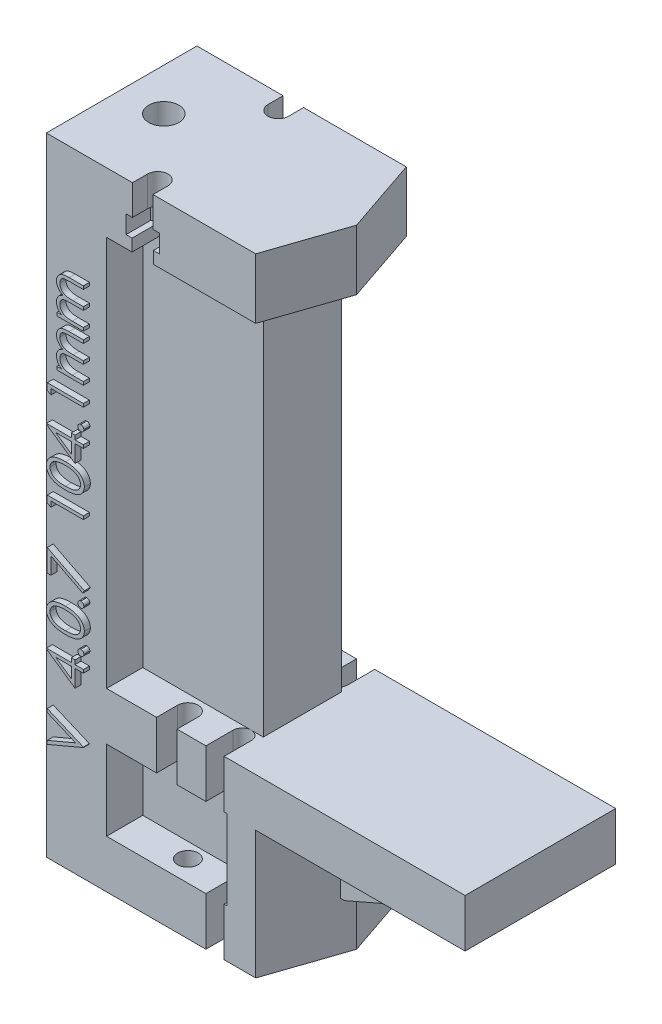
from build123d import *
from build123d.topology import SkipClean

# Parameters (mm, degrees)
BOSS_EXTRUDE2_DEPTH              = 12.5
BOSS_EXTRUDE3_DEPTH              = 25
CUT_EXTRUDE2_REACH               = 109.787
CUT_EXTRUDE3_REACH               = 109.787
CUT_EXTRUDE6_REACH               = 109.787
SKETCH30_W                       = 10
SKETCH30_H                       = 25
CUT_EXTRUDE8_DEPTH               = 8
CUT_EXTRUDE9_DEPTH               = 80.90319784
CUT_EXTRUDE9_DEPTH_BACK          = 80.90319784
BOSS_EXTRUDE6_DEPTH              = 1
BOSS_EXTRUDE7_DEPTH              = 40
BOSS_EXTRUDE17_DEPTH             = 2
CUT_EXTRUDE10_DEPTH              = 3
SKETCH39_W                       = 4
SKETCH39_H                       = 13.245
BOSS_EXTRUDE18_DEPTH             = 2.5
F_5_0MM_DOWEL_HOLE1_D            = 5
F_5_0MM_DOWEL_HOLE1_DEPTH        = 5
F_5_0MM_DOWEL_HOLE1_TIP          = 1.502151548
BOSS_EXTRUDE19_DEPTH             = 2
BOSS_EXTRUDE20_DEPTH             = 8
BOSS_EXTRUDE21_REACH             = 90.129
SKETCH45_W                       = 20
SKETCH45_H                       = 12.98
BOSS_EXTRUDE21_DIRECTION_2_REACH = 90.129


with BuildPart() as part:
    # Sketch6 → Boss-Extrude2 (new, symmetric)
    with BuildSketch(Plane.XY):
        Polygon((-25, 52.05), (15, 52.05), (15, 44.05), (-15, 44.05), (-15, -44.05), (25, -44.05), (25, -52.05), (-25, -52.05), align=None)
    extrude(amount=BOSS_EXTRUDE2_DEPTH, both=True)

    # Sketch15 → Boss-Extrude3 (add)
    with BuildSketch(Plane.XY.offset(12.5)):
        Polygon((-15, -22.805), (15, -22.805), (15, -52.05), (5, -52.05), (5, -30.805), (-15, -30.805), align=None)
    extrude(amount=-BOSS_EXTRUDE3_DEPTH)

    # Sketch20 → Cut-Extrude2 (cut, up to next)
    with BuildSketch(Plane(origin=(0, 52.05, 0), x_dir=(1, 0, 0), z_dir=(0, 1, 0)), mode=Mode.PRIVATE) as cut_extrude2_sk1:
        with BuildLine():
            Line((-10.7, 12.5), (-10.7, 10))
            ThreePointArc((-10.7, 10), (-9, 8.3), (-7.3, 10))
            Line((-7.3, 10), (-7.3, 12.5))
            Line((-7.3, 12.5), (-10.7, 12.5))
        make_face()
    cut_extrude2_tool1 = extrude(cut_extrude2_sk1.sketch, amount=-CUT_EXTRUDE2_REACH, mode=Mode.PRIVATE) & part.part
    # Sketch20 → Cut-Extrude2 (cut, up to next)
    with BuildSketch(Plane(origin=(0, 52.05, 0), x_dir=(1, 0, 0), z_dir=(0, 1, 0)), mode=Mode.PRIVATE) as cut_extrude2_sk2:
        with BuildLine():
            Line((-7.3, -12.5), (-10.7, -12.5))
            Line((-10.7, -12.5), (-10.7, -10))
            ThreePointArc((-10.7, -10), (-9, -8.3), (-7.3, -10))
            Line((-7.3, -10), (-7.3, -12.5))
        make_face()
    cut_extrude2_tool2 = extrude(cut_extrude2_sk2.sketch, amount=-CUT_EXTRUDE2_REACH, mode=Mode.PRIVATE) & part.part
    add(cut_extrude2_tool1.solids().sort_by_distance((-9, 52.05, -10.563642))[0], mode=Mode.SUBTRACT)
    add(cut_extrude2_tool2.solids().sort_by_distance((-9, 52.05, 10.563642))[0], mode=Mode.SUBTRACT)

    # Cut-Extrude3: up to this face of the body (flat: up to its plane)
    cut_extrude3_end = Plane(part.part.faces().sort_by_distance((0, -22.805, 0))[0])
    # Sketch21 → Cut-Extrude3 (cut, up to the picked face)
    with BuildSketch(Plane.XZ.offset(52.05), mode=Mode.PRIVATE) as cut_extrude3_sk1:
        with BuildLine():
            Line((-6.7, 12.5), (-6.7, 9))
            ThreePointArc((-6.7, 9), (-5, 7.3), (-3.3, 9))
            Line((-3.3, 9), (-3.3, 12.5))
            Line((-3.3, 12.5), (-6.7, 12.5))
        make_face()
    cut_extrude3_tool1 = split(extrude(cut_extrude3_sk1.sketch, amount=-CUT_EXTRUDE3_REACH, mode=Mode.PRIVATE), bisect_by=cut_extrude3_end, keep=Keep.BOTH, mode=Mode.PRIVATE)
    # Sketch21 → Cut-Extrude3 (cut, up to the picked face)
    with BuildSketch(Plane.XZ.offset(52.05), mode=Mode.PRIVATE) as cut_extrude3_sk2:
        with BuildLine():
            Line((-3.3, -12.5), (-6.7, -12.5))
            Line((-6.7, -12.5), (-6.7, -9))
            ThreePointArc((-6.7, -9), (-5, -7.3), (-3.3, -9))
            Line((-3.3, -9), (-3.3, -12.5))
        make_face()
    cut_extrude3_tool2 = split(extrude(cut_extrude3_sk2.sketch, amount=-CUT_EXTRUDE3_REACH, mode=Mode.PRIVATE), bisect_by=cut_extrude3_end, keep=Keep.BOTH, mode=Mode.PRIVATE)
    add(cut_extrude3_tool1.solids().sort_by(Axis((-5, -52.05, 10.067524), (0, 1, 0)))[0], mode=Mode.SUBTRACT)
    add(cut_extrude3_tool2.solids().sort_by(Axis((-5, -52.05, -10.067524), (0, 1, 0)))[0], mode=Mode.SUBTRACT)

    # Cut-Extrude6: up to this face of the body (flat: up to its plane)
    cut_extrude6_end = Plane(part.part.faces().sort_by_distance((0.229244521, -22.805, 0))[0])
    # Sketch24 → Cut-Extrude6 (cut, up to the picked face)
    with BuildSketch(Plane.XZ.offset(52.05), mode=Mode.PRIVATE) as cut_extrude6_sk1:
        with BuildLine():
            Line((1.49, -12.5), (1.49, -8))
            ThreePointArc((1.49, -8), (3, -6.49), (4.51, -8))
            Line((4.51, -8), (4.51, -12.5))
            Line((4.51, -12.5), (1.49, -12.5))
        make_face()
    cut_extrude6_tool1 = split(extrude(cut_extrude6_sk1.sketch, amount=-CUT_EXTRUDE6_REACH, mode=Mode.PRIVATE), bisect_by=cut_extrude6_end, keep=Keep.BOTH, mode=Mode.PRIVATE)
    # Sketch24 → Cut-Extrude6 (cut, up to the picked face)
    with BuildSketch(Plane.XZ.offset(52.05), mode=Mode.PRIVATE) as cut_extrude6_sk2:
        with BuildLine():
            Line((4.51, 12.5), (1.49, 12.5))
            Line((1.49, 12.5), (1.49, 8))
            ThreePointArc((1.49, 8), (3, 6.49), (4.51, 8))
            Line((4.51, 8), (4.51, 12.5))
        make_face()
    cut_extrude6_tool2 = split(extrude(cut_extrude6_sk2.sketch, amount=-CUT_EXTRUDE6_REACH, mode=Mode.PRIVATE), bisect_by=cut_extrude6_end, keep=Keep.BOTH, mode=Mode.PRIVATE)
    add(cut_extrude6_tool1.solids().sort_by(Axis((3, -52.05, -9.647036), (0, 1, 0)))[0], mode=Mode.SUBTRACT)
    add(cut_extrude6_tool2.solids().sort_by(Axis((3, -52.05, 9.647036), (0, 1, 0)))[0], mode=Mode.SUBTRACT)

    # Sketch30 → Cut-Extrude8 (cut)
    with BuildSketch(Plane(origin=(0, -44.05, 0), x_dir=(1, 0, 0), z_dir=(0, 1, 0))):
        with Locations((20, 0)):
            Rectangle(SKETCH30_W, SKETCH30_H)
    extrude(amount=-CUT_EXTRUDE8_DEPTH, mode=Mode.SUBTRACT)

    # Sketch34 → Cut-Extrude9 (cut, two sides: drawn at the far end of the back side and taken through both)
    with BuildSketch(Plane(origin=(0, -22.805, 0), x_dir=(1, 0, 0), z_dir=(0, 1, 0)).offset(-CUT_EXTRUDE9_DEPTH_BACK)):
        Polygon((9.755, 12.5), (14, 0), (9.755, -12.5), (15, -12.5), (15, 12.5), align=None)
    extrude(amount=CUT_EXTRUDE9_DEPTH + CUT_EXTRUDE9_DEPTH_BACK, mode=Mode.SUBTRACT)

    # Sketch35 → Boss-Extrude6 (add)
    # profile 1 of 13: a face of its own
    with BuildSketch(Plane.XY.offset(12.5)):
        with BuildLine():
            Line((-22.234615385, 27.615384615), (-22.234615385, 28.153846154))
            Line((-22.234615385, 28.153846154), (-21.472596154, 28.153846154))
            add(Edge.make_bspline(
                [(-21.472596154, 28.153846154), (-21.539260614, 28.202332925), (-21.666996111, 28.295238227), (-21.835322312, 28.447579346), (-21.978170577, 28.599766967), (-22.053158357, 28.70936705), (-22.089182692, 28.762019231)],
                knots=[0, 0, 0, 0, 1.134379233, 2.173579362, 3.122582517, 4, 4, 4, 4], degree=3))
            add(Edge.make_bspline(
                [(-22.089182692, 28.762019231), (-22.123477604, 28.833787223), (-22.191468256, 28.976069337), (-22.260440071, 29.201359437), (-22.302825959, 29.431887442), (-22.308622599, 29.587558666), (-22.311538462, 29.665865385)],
                knots=[0, 0, 0, 0, 1.014936303, 2.012140481, 3.000054389, 4, 4, 4, 4], degree=3))
            add(Edge.make_bspline(
                [(-22.311538462, 29.665865385), (-22.309746507, 29.718824779), (-22.306200324, 29.823628574), (-22.283126386, 29.978915994), (-22.243239974, 30.129529211), (-22.187690322, 30.274587601), (-22.120389321, 30.411230628), (-22.041520642, 30.536600172), (-21.952811526, 30.648610476), (-21.851715073, 30.749056719), (-21.732621113, 30.83858538), (-21.593245652, 30.920361942), (-21.431579845, 30.996927786), (-21.314358593, 31.039096955), (-21.252644231, 31.061298077)],
                knots=[0, 0, 0, 0, 1.009731074, 1.9982035, 2.985760524, 3.974587072, 4.955028184, 5.885388378, 6.793242796, 7.673688873, 8.594941726, 9.625945874, 10.750113716, 12, 12, 12, 12], degree=3))
            add(Edge.make_bspline(
                [(-21.252644231, 31.061298077), (-21.295028488, 31.084803509), (-21.378434755, 31.131058898), (-21.496484081, 31.208719564), (-21.60687165, 31.290115359), (-21.709826129, 31.375808349), (-21.80452798, 31.466158417), (-21.892909205, 31.559709831), (-21.972522012, 31.65855761), (-22.065676161, 31.795282971), (-22.164941217, 31.97298822), (-22.248837086, 32.197914933), (-22.302266055, 32.431002803), (-22.308427236, 32.589456464), (-22.311538462, 32.669471154)],
                knots=[0, 0, 0, 0, 0.861026002, 1.694378253, 2.508904292, 3.297437177, 4.073006284, 4.833627155, 5.583069468, 6.325614666, 7.772320565, 9.187282923, 10.579656144, 12, 12, 12, 12], degree=3))
            add(Edge.make_bspline(
                [(-22.311538462, 32.669471154), (-22.308800813, 32.742995007), (-22.30344297, 32.886888326), (-22.260375554, 33.096018305), (-22.189095041, 33.291888325), (-22.088852441, 33.472422361), (-21.963482389, 33.635522594), (-21.814139706, 33.777834074), (-21.641369838, 33.896227786), (-21.480136821, 33.975377221), (-21.337524673, 34.028068152), (-21.215460368, 34.060975775), (-21.081004779, 34.089485755), (-20.934266049, 34.113657918), (-20.774947077, 34.131133284), (-20.602974661, 34.144124267), (-20.418199364, 34.152904699), (-20.290715767, 34.153525923), (-20.225, 34.153846154)],
                knots=[0, 0, 0, 0, 1.209392158, 2.366897878, 3.497663982, 4.628180075, 5.751982922, 6.871462727, 8.009245026, 9.185977379, 9.818124946, 10.509294143, 11.264649411, 12.079922034, 12.956003306, 13.901808055, 14.918415426, 16, 16, 16, 16], degree=3))
            Line((-20.225, 34.153846154), (-17.85, 34.153846154))
            Line((-17.85, 34.153846154), (-17.85, 33.615384615))
            Line((-17.85, 33.615384615), (-20.227403846, 33.615384615))
            add(Edge.make_bspline(
                [(-20.227403846, 33.615384615), (-20.283496341, 33.61525175), (-20.391297586, 33.614996403), (-20.546014988, 33.610370226), (-20.687050044, 33.60169783), (-20.814586843, 33.591401636), (-20.928585361, 33.577484141), (-21.028726359, 33.559108709), (-21.115466742, 33.539796341), (-21.211587244, 33.507636113), (-21.317531947, 33.456700435), (-21.430954892, 33.377701419), (-21.530458078, 33.279661851), (-21.616841526, 33.165831979), (-21.687129696, 33.036339747), (-21.737313417, 32.893594816), (-21.768382244, 32.738515088), (-21.771478124, 32.631161524), (-21.773076923, 32.575721154)],
                knots=[0, 0, 0, 0, 1.253367865, 2.408782419, 3.458086102, 4.410454771, 5.267690823, 6.022776742, 6.685072793, 7.251272234, 8.28433411, 9.300106008, 10.325693114, 11.39283262, 12.482417211, 13.60372085, 14.762494729, 16, 16, 16, 16], degree=3))
            add(Edge.make_bspline(
                [(-21.773076923, 32.575721154), (-21.76997183, 32.50777098), (-21.763840459, 32.373595416), (-21.717743069, 32.176588739), (-21.641126709, 31.989288216), (-21.536341225, 31.812958398), (-21.407618816, 31.652246316), (-21.255294615, 31.513477382), (-21.082742522, 31.3989302), (-20.92307314, 31.321348132), (-20.779638783, 31.272334455), (-20.654327211, 31.239989762), (-20.511520556, 31.214678274), (-20.352893327, 31.191399346), (-20.177094809, 31.175688837), (-19.985210505, 31.161810327), (-19.775926859, 31.155231794), (-19.63085208, 31.15431971), (-19.555528846, 31.153846154)],
                knots=[0, 0, 0, 0, 1.091136677, 2.154576964, 3.231646693, 4.331257757, 5.439166191, 6.528231045, 7.628049365, 8.756709726, 9.369482423, 10.061167346, 10.833871401, 11.698739631, 12.636505159, 13.668922441, 14.789697963, 16, 16, 16, 16], degree=3))
            Line((-19.555528846, 31.153846154), (-17.85, 31.153846154))
            Line((-17.85, 31.153846154), (-17.85, 30.615384615))
            Line((-17.85, 30.615384615), (-20.079567308, 30.615384615))
            add(Edge.make_bspline(
                [(-20.079567308, 30.615384615), (-20.14247014, 30.615248448), (-20.263488866, 30.614986475), (-20.437032312, 30.610398505), (-20.594885583, 30.601678575), (-20.736865264, 30.591597658), (-20.862713168, 30.577094421), (-20.973104451, 30.56062077), (-21.067760922, 30.54116532), (-21.17158701, 30.508956742), (-21.285945136, 30.459714552), (-21.407983755, 30.380604381), (-21.514604324, 30.281417491), (-21.607034555, 30.166349159), (-21.682563185, 30.035870107), (-21.73505501, 29.891423368), (-21.767080197, 29.735375076), (-21.771040318, 29.627561566), (-21.773076923, 29.572115385)],
                knots=[0, 0, 0, 0, 1.320285835, 2.540097241, 3.643286278, 4.638464947, 5.527188413, 6.301437306, 6.980978976, 7.552872752, 8.580906713, 9.583871393, 10.589652407, 11.624542289, 12.671761011, 13.738681301, 14.837052193, 16, 16, 16, 16], degree=3))
            add(Edge.make_bspline(
                [(-21.773076923, 29.572115385), (-21.770453269, 29.506944753), (-21.765224419, 29.377061998), (-21.718160076, 29.186258376), (-21.644438314, 29.001998159), (-21.542166243, 28.827214974), (-21.415474903, 28.666644721), (-21.266504635, 28.526007243), (-21.097243672, 28.408221402), (-20.939930706, 28.329292274), (-20.800047184, 28.278690912), (-20.680645905, 28.245515012), (-20.548314964, 28.216395158), (-20.402780158, 28.194994017), (-20.24469108, 28.174269247), (-20.073236398, 28.164279089), (-19.888570334, 28.154555048), (-19.761074488, 28.154088248), (-19.694951923, 28.153846154)],
                knots=[0, 0, 0, 0, 1.09880202, 2.189873405, 3.297736452, 4.440485332, 5.596193377, 6.739822772, 7.886349079, 9.066114917, 9.699498033, 10.395421758, 11.156987371, 11.985484089, 12.878178647, 13.847820956, 14.883825601, 16, 16, 16, 16], degree=3))
            Line((-19.694951923, 28.153846154), (-17.85, 28.153846154))
            Line((-17.85, 28.153846154), (-17.85, 27.615384615))
            Line((-17.85, 27.615384615), (-22.234615385, 27.615384615))
        make_face()
    # profile 2 of 13: a face of its own
    with BuildSketch(Plane.XY.offset(12.5)):
        with BuildLine():
            Line((-22.234615385, 19.846153846), (-22.234615385, 20.384615385))
            Line((-22.234615385, 20.384615385), (-21.472596154, 20.384615385))
            add(Edge.make_bspline(
                [(-21.472596154, 20.384615385), (-21.539260614, 20.433102156), (-21.666996111, 20.526007458), (-21.835322312, 20.678348577), (-21.978170577, 20.830536198), (-22.053158357, 20.940136281), (-22.089182692, 20.992788462)],
                knots=[0, 0, 0, 0, 1.134379233, 2.173579362, 3.122582517, 4, 4, 4, 4], degree=3))
            add(Edge.make_bspline(
                [(-22.089182692, 20.992788462), (-22.123477604, 21.064556454), (-22.191468256, 21.206838568), (-22.260440071, 21.432128668), (-22.302825959, 21.662656672), (-22.308622599, 21.818327896), (-22.311538462, 21.896634615)],
                knots=[0, 0, 0, 0, 1.014936303, 2.012140481, 3.000054389, 4, 4, 4, 4], degree=3))
            add(Edge.make_bspline(
                [(-22.311538462, 21.896634615), (-22.309746507, 21.94959401), (-22.306200324, 22.054397804), (-22.283126386, 22.209685225), (-22.243239974, 22.360298442), (-22.187690322, 22.505356831), (-22.120389321, 22.641999859), (-22.041520642, 22.767369402), (-21.952811526, 22.879379707), (-21.851715073, 22.97982595), (-21.732621113, 23.069354611), (-21.593245652, 23.151131173), (-21.431579845, 23.227697017), (-21.314358593, 23.269866186), (-21.252644231, 23.292067308)],
                knots=[0, 0, 0, 0, 1.009731074, 1.9982035, 2.985760524, 3.974587072, 4.955028184, 5.885388378, 6.793242796, 7.673688873, 8.594941726, 9.625945874, 10.750113716, 12, 12, 12, 12], degree=3))
            add(Edge.make_bspline(
                [(-21.252644231, 23.292067308), (-21.295028488, 23.31557274), (-21.378434755, 23.361828129), (-21.496484081, 23.439488795), (-21.60687165, 23.52088459), (-21.709826129, 23.60657758), (-21.80452798, 23.696927648), (-21.892909205, 23.790479062), (-21.972522012, 23.889326841), (-22.065676161, 24.026052201), (-22.164941217, 24.20375745), (-22.248837086, 24.428684164), (-22.302266055, 24.661772034), (-22.308427236, 24.820225695), (-22.311538462, 24.900240385)],
                knots=[0, 0, 0, 0, 0.861026002, 1.694378253, 2.508904292, 3.297437177, 4.073006284, 4.833627155, 5.583069468, 6.325614666, 7.772320565, 9.187282923, 10.579656144, 12, 12, 12, 12], degree=3))
            add(Edge.make_bspline(
                [(-22.311538462, 24.900240385), (-22.308800813, 24.973764238), (-22.30344297, 25.117657557), (-22.260375554, 25.326787536), (-22.189095041, 25.522657555), (-22.088852441, 25.703191592), (-21.963482389, 25.866291825), (-21.814139706, 26.008603304), (-21.641369838, 26.126997017), (-21.480136821, 26.206146451), (-21.337524673, 26.258837383), (-21.215460368, 26.291745005), (-21.081004779, 26.320254985), (-20.934266049, 26.344427149), (-20.774947077, 26.361902515), (-20.602974661, 26.374893498), (-20.418199364, 26.38367393), (-20.290715767, 26.384295154), (-20.225, 26.384615385)],
                knots=[0, 0, 0, 0, 1.209392158, 2.366897878, 3.497663982, 4.628180075, 5.751982922, 6.871462727, 8.009245026, 9.185977379, 9.818124946, 10.509294143, 11.264649411, 12.079922034, 12.956003306, 13.901808055, 14.918415426, 16, 16, 16, 16], degree=3))
            Line((-20.225, 26.384615385), (-17.85, 26.384615385))
            Line((-17.85, 26.384615385), (-17.85, 25.846153846))
            Line((-17.85, 25.846153846), (-20.227403846, 25.846153846))
            add(Edge.make_bspline(
                [(-20.227403846, 25.846153846), (-20.283496341, 25.846020981), (-20.391297586, 25.845765633), (-20.546014988, 25.841139457), (-20.687050044, 25.832467061), (-20.814586843, 25.822170867), (-20.928585361, 25.808253372), (-21.028726359, 25.78987794), (-21.115466742, 25.770565572), (-21.211587244, 25.738405344), (-21.317531947, 25.687469666), (-21.430954892, 25.608470649), (-21.530458078, 25.510431082), (-21.616841526, 25.396601209), (-21.687129696, 25.267108977), (-21.737313417, 25.124364047), (-21.768382244, 24.969284319), (-21.771478124, 24.861930754), (-21.773076923, 24.806490385)],
                knots=[0, 0, 0, 0, 1.253367865, 2.408782419, 3.458086102, 4.410454771, 5.267690823, 6.022776742, 6.685072793, 7.251272234, 8.28433411, 9.300106008, 10.325693114, 11.39283262, 12.482417211, 13.60372085, 14.762494729, 16, 16, 16, 16], degree=3))
            add(Edge.make_bspline(
                [(-21.773076923, 24.806490385), (-21.76997183, 24.738540211), (-21.763840459, 24.604364647), (-21.717743069, 24.40735797), (-21.641126709, 24.220057447), (-21.536341225, 24.043727629), (-21.407618816, 23.883015547), (-21.255294615, 23.744246613), (-21.082742522, 23.62969943), (-20.92307314, 23.552117362), (-20.779638783, 23.503103686), (-20.654327211, 23.470758993), (-20.511520556, 23.445447505), (-20.352893327, 23.422168577), (-20.177094809, 23.406458068), (-19.985210505, 23.392579558), (-19.775926859, 23.386001025), (-19.63085208, 23.385088941), (-19.555528846, 23.384615385)],
                knots=[0, 0, 0, 0, 1.091136677, 2.154576964, 3.231646693, 4.331257757, 5.439166191, 6.528231045, 7.628049365, 8.756709726, 9.369482423, 10.061167346, 10.833871401, 11.698739631, 12.636505159, 13.668922441, 14.789697963, 16, 16, 16, 16], degree=3))
            Line((-19.555528846, 23.384615385), (-17.85, 23.384615385))
            Line((-17.85, 23.384615385), (-17.85, 22.846153846))
            Line((-17.85, 22.846153846), (-20.079567308, 22.846153846))
            add(Edge.make_bspline(
                [(-20.079567308, 22.846153846), (-20.14247014, 22.846017679), (-20.263488866, 22.845755706), (-20.437032312, 22.841167736), (-20.594885583, 22.832447805), (-20.736865264, 22.822366889), (-20.862713168, 22.807863652), (-20.973104451, 22.791390001), (-21.067760922, 22.771934551), (-21.17158701, 22.739725972), (-21.285945136, 22.690483782), (-21.407983755, 22.611373611), (-21.514604324, 22.512186722), (-21.607034555, 22.39711839), (-21.682563185, 22.266639338), (-21.73505501, 22.122192599), (-21.767080197, 21.966144307), (-21.771040318, 21.858330796), (-21.773076923, 21.802884615)],
                knots=[0, 0, 0, 0, 1.320285835, 2.540097241, 3.643286278, 4.638464947, 5.527188413, 6.301437306, 6.980978976, 7.552872752, 8.580906713, 9.583871393, 10.589652407, 11.624542289, 12.671761011, 13.738681301, 14.837052193, 16, 16, 16, 16], degree=3))
            add(Edge.make_bspline(
                [(-21.773076923, 21.802884615), (-21.770453269, 21.737713984), (-21.765224419, 21.607831229), (-21.718160076, 21.417027607), (-21.644438314, 21.232767389), (-21.542166243, 21.057984205), (-21.415474903, 20.897413952), (-21.266504635, 20.756776474), (-21.097243672, 20.638990632), (-20.939930706, 20.560061505), (-20.800047184, 20.509460143), (-20.680645905, 20.476284243), (-20.548314964, 20.447164389), (-20.402780158, 20.425763248), (-20.24469108, 20.405038478), (-20.073236398, 20.39504832), (-19.888570334, 20.385324279), (-19.761074488, 20.384857479), (-19.694951923, 20.384615385)],
                knots=[0, 0, 0, 0, 1.09880202, 2.189873405, 3.297736452, 4.440485332, 5.596193377, 6.739822772, 7.886349079, 9.066114917, 9.699498033, 10.395421758, 11.156987371, 11.985484089, 12.878178647, 13.847820956, 14.883825601, 16, 16, 16, 16], degree=3))
            Line((-19.694951923, 20.384615385), (-17.85, 20.384615385))
            Line((-17.85, 20.384615385), (-17.85, 19.846153846))
            Line((-17.85, 19.846153846), (-22.234615385, 19.846153846))
        make_face()
    # profile 3 of 13: a face of its own
    with BuildSketch(Plane.XY.offset(12.5)):
        Polygon((-23.85, 16.121394231), (-23.85, 17.230769231), (-17.85, 17.230769231), (-17.85, 16.692307692), (-23.234615385, 16.692307692), (-23.234615385, 15.769230769), align=None)
    # profile 4 of 13: a face of its own
    with BuildSketch(Plane.XY.offset(12.5)):
        with BuildLine():
            add(Edge.make_bspline(
                [(-18.773076923, 13.5), (-18.771091494, 13.533411792), (-18.767199294, 13.598911705), (-18.740496425, 13.693607354), (-18.693081578, 13.779312484), (-18.629888244, 13.855653476), (-18.553267107, 13.918578864), (-18.468245549, 13.967683467), (-18.372757105, 13.994153728), (-18.306877662, 13.998017577), (-18.273076923, 14)],
                knots=[0, 0, 0, 0, 1.020151414, 1.999887582, 2.974338812, 3.990962822, 5.007586832, 5.987933904, 6.967670073, 8, 8, 8, 8], degree=3))
            add(Edge.make_bspline(
                [(-18.273076923, 14), (-18.240082695, 13.997956712), (-18.17501856, 13.993927377), (-18.080332316, 13.967671525), (-17.995213248, 13.918638474), (-17.918771705, 13.855253112), (-17.854052036, 13.779769027), (-17.807265803, 13.693339216), (-17.778559122, 13.599151168), (-17.774926676, 13.53345467), (-17.773076923, 13.5)],
                knots=[0, 0, 0, 0, 1.009624703, 1.990965087, 2.972917375, 3.991206001, 5.017354006, 5.993400798, 6.978178195, 8, 8, 8, 8], degree=3))
            add(Edge.make_bspline(
                [(-17.773076923, 13.5), (-17.774859529, 13.466521236), (-17.778339643, 13.40116192), (-17.807852551, 13.307325026), (-17.853605582, 13.220368422), (-17.918889524, 13.144903952), (-17.994817845, 13.081004939), (-18.080918523, 13.034147269), (-18.174747202, 13.005614924), (-18.240029244, 13.001887122), (-18.273076923, 13)],
                knots=[0, 0, 0, 0, 1.022258411, 1.995716197, 2.98297171, 4.009558169, 5.028281891, 6.00474573, 6.989943903, 8, 8, 8, 8], degree=3))
            add(Edge.make_bspline(
                [(-18.273076923, 13), (-18.306933002, 13.001820742), (-18.373032842, 13.005375516), (-18.467659884, 13.034133791), (-18.553662923, 13.08106444), (-18.629771346, 13.14450226), (-18.693521007, 13.220829624), (-18.739917796, 13.30705169), (-18.767415645, 13.401405188), (-18.771157102, 13.466565082), (-18.773076923, 13.5)],
                knots=[0, 0, 0, 0, 1.032775665, 2.016367738, 2.991239715, 4.008302682, 5.025365648, 6.011011707, 6.979408107, 8, 8, 8, 8], degree=3))
        make_face()
    # profile 5 of 13: a face of its own
    with BuildSketch(Plane.XY.offset(12.5)):
        Polygon((-24.003846154, 11.198317308), (-24.003846154, 11.307692308), (-19.85, 11.307692308), (-19.85, 12), (-19.234615385, 12), (-19.234615385, 11.307692308), (-17.85, 11.307692308), (-17.85, 10.769230769), (-19.234615385, 10.769230769), (-19.234615385, 7.923076923), align=None)
        Polygon((-19.85, 10.769230769), (-22.455769231, 10.769230769), (-19.85, 8.980769231), align=None, mode=Mode.SUBTRACT)
    # profile 6 of 13: a face of its own
    with BuildSketch(Plane.XY.offset(12.5)):
        with BuildLine():
            add(Edge.make_bspline(
                [(-20.847596154, 3.307692308), (-20.943763104, 3.308254625), (-21.130568792, 3.309346933), (-21.402771035, 3.321498512), (-21.658131531, 3.341684813), (-21.8966625, 3.369348882), (-22.118425529, 3.403013987), (-22.322827956, 3.447954834), (-22.5108159, 3.499062452), (-22.683002111, 3.558295363), (-22.841707287, 3.625131068), (-22.989862864, 3.697877295), (-23.12725581, 3.779410631), (-23.256039225, 3.865107901), (-23.374246225, 3.958305288), (-23.483238776, 4.057004464), (-23.582097725, 4.163179426), (-23.67089077, 4.275800373), (-23.748749314, 4.394104021), (-23.817752138, 4.514857575), (-23.874589397, 4.64021863), (-23.921083839, 4.76853688), (-23.959038325, 4.900082771), (-23.985109169, 5.03482272), (-24.001483733, 5.173069065), (-24.003051209, 5.266379549), (-24.003846154, 5.313701923)],
                knots=[0, 0, 0, 0, 1.646148282, 3.197666765, 4.66315463, 6.030252048, 7.307778049, 8.501004361, 9.610818041, 10.641065266, 11.615491391, 12.557119604, 13.464013759, 14.348536654, 15.203310953, 16.038349431, 16.863300206, 17.683791446, 18.490318933, 19.285717724, 20.06220424, 20.843281102, 21.620494212, 22.403315558, 23.190242141, 24, 24, 24, 24], degree=3))
            add(Edge.make_bspline(
                [(-24.003846154, 5.313701923), (-24.003184011, 5.361443028), (-24.00186658, 5.456431023), (-23.983322948, 5.596359849), (-23.959388145, 5.733851353), (-23.921000663, 5.866819518), (-23.875065063, 5.997778517), (-23.814453767, 6.12347166), (-23.748534277, 6.248336583), (-23.668118043, 6.366700838), (-23.579244872, 6.482100932), (-23.478351101, 6.590276472), (-23.368228979, 6.693992714), (-23.246422458, 6.789332334), (-23.114799194, 6.880381458), (-22.972255805, 6.963683769), (-22.819108188, 7.040971802), (-22.656066311, 7.113698368), (-22.478775073, 7.177295829), (-22.288340287, 7.233839056), (-22.083037474, 7.280185797), (-21.8640103, 7.318513738), (-21.630173709, 7.348263516), (-21.382001479, 7.369914901), (-21.119338352, 7.381355776), (-20.939753411, 7.383509938), (-20.847596154, 7.384615385)],
                knots=[0, 0, 0, 0, 0.810910589, 1.61342667, 2.396193133, 3.181089899, 3.963115317, 4.752255436, 5.550715454, 6.36105385, 7.181178335, 8.024612154, 8.872680183, 9.750181803, 10.651284446, 11.591556747, 12.554036451, 13.566402641, 14.62422919, 15.753422176, 16.94128843, 18.199818041, 19.531985927, 20.947085226, 22.433341622, 24, 24, 24, 24], degree=3))
            add(Edge.make_bspline(
                [(-20.847596154, 7.384615385), (-20.755841687, 7.383485617), (-20.576661658, 7.381279384), (-20.315168068, 7.370160276), (-20.06833354, 7.347734672), (-19.835894914, 7.320092294), (-19.61774442, 7.281335965), (-19.414024206, 7.234637795), (-19.22401301, 7.181432174), (-19.049072236, 7.116858663), (-18.886313286, 7.045824867), (-18.734291753, 6.96861977), (-18.591786008, 6.885787548), (-18.459815568, 6.796103949), (-18.338497958, 6.699196089), (-18.227998136, 6.595552543), (-18.126462639, 6.486432504), (-18.036610349, 6.370359647), (-17.955581867, 6.250892902), (-17.887270195, 6.126015294), (-17.828082139, 5.998922777), (-17.779690445, 5.868346453), (-17.74216212, 5.734487925), (-17.716363441, 5.596902184), (-17.698228951, 5.456411277), (-17.696847943, 5.361436423), (-17.696153846, 5.313701923)],
                knots=[0, 0, 0, 0, 1.561645053, 3.049612875, 4.452756685, 5.778837748, 7.032101753, 8.221335837, 9.334924186, 10.387562255, 11.392109817, 12.355697819, 13.287721948, 14.19548756, 15.068665045, 15.927346723, 16.771751757, 17.602390507, 18.423119567, 19.225778204, 20.022010933, 20.807278863, 21.593079439, 22.384715467, 23.188155646, 24, 24, 24, 24], degree=3))
            add(Edge.make_bspline(
                [(-17.696153846, 5.313701923), (-17.696953313, 5.266380585), (-17.698529705, 5.173072142), (-17.714838958, 5.034810841), (-17.741059822, 4.900612368), (-17.777773997, 4.769814499), (-17.82271373, 4.641746208), (-17.88126285, 4.518152496), (-17.948692879, 4.397659616), (-18.025484279, 4.280587265), (-18.113467177, 4.169142095), (-18.210766452, 4.062671154), (-18.319877187, 3.963947639), (-18.439081549, 3.871558356), (-18.568056572, 3.784955113), (-18.706888809, 3.704126332), (-18.855815319, 3.629854561), (-19.015774756, 3.56187698), (-19.189183067, 3.501607269), (-19.377650209, 3.448575809), (-19.583090447, 3.40622121), (-19.80446072, 3.37031914), (-20.042210834, 3.341550341), (-20.296426807, 3.321506894), (-20.566625901, 3.309356158), (-20.752230327, 3.308257045), (-20.847596154, 3.307692308)],
                knots=[0, 0, 0, 0, 0.810927267, 1.598990287, 2.382942141, 3.152806972, 3.926217614, 4.706701772, 5.493896336, 6.292070767, 7.104102563, 7.925577746, 8.761822141, 9.623241997, 10.509042271, 11.423174113, 12.375371989, 13.360203808, 14.400680605, 15.520553799, 16.714061498, 17.994519714, 19.364400916, 20.818312473, 22.365209998, 24, 24, 24, 24], degree=3))
        make_face()
        with BuildLine():
            add(Edge.make_bspline(
                [(-20.85, 3.846153846), (-20.769859694, 3.846363103), (-20.614323096, 3.846769228), (-20.388701112, 3.857071927), (-20.177909913, 3.871412233), (-19.982031768, 3.889453163), (-19.801751265, 3.916472021), (-19.636318913, 3.947126567), (-19.486040925, 3.983894824), (-19.349604048, 4.027612784), (-19.225076282, 4.077411794), (-19.109138521, 4.131688098), (-19.000416685, 4.190512961), (-18.899174551, 4.255092167), (-18.806649691, 4.326702492), (-18.720496813, 4.402024071), (-18.643712237, 4.484450102), (-18.551605787, 4.598451448), (-18.456431673, 4.748962083), (-18.373552195, 4.938596427), (-18.321468101, 5.13345681), (-18.314844504, 5.265716072), (-18.311538462, 5.331730769)],
                knots=[0, 0, 0, 0, 1.459098681, 2.831824031, 4.11146945, 5.306290378, 6.412266529, 7.42953815, 8.369053297, 9.227277979, 10.03601793, 10.809473603, 11.557037441, 12.285528272, 12.993193355, 13.685654407, 14.36688038, 15.041354379, 16.352855396, 17.594313975, 18.799247529, 20, 20, 20, 20], degree=3))
            add(Edge.make_bspline(
                [(-18.311538462, 5.331730769), (-18.314433297, 5.3981276), (-18.320212699, 5.530685739), (-18.370653042, 5.725367123), (-18.452653022, 5.9128011), (-18.546336056, 6.060722008), (-18.636124672, 6.17294532), (-18.712589838, 6.25338114), (-18.798233217, 6.327199934), (-18.89063069, 6.397215436), (-18.991555316, 6.461430851), (-19.100519627, 6.519824842), (-19.217826818, 6.573110569), (-19.299717795, 6.603468935), (-19.341586538, 6.618990385)],
                knots=[0, 0, 0, 0, 1.353621445, 2.702441307, 4.075953605, 5.516772412, 6.261413105, 7.007624062, 7.778524365, 8.566925914, 9.372323995, 10.217594641, 11.088702136, 12, 12, 12, 12], degree=3))
            add(Edge.make_bspline(
                [(-19.341586538, 6.618990385), (-19.395123235, 6.637079129), (-19.503825688, 6.673807039), (-19.672449091, 6.721141509), (-19.849368115, 6.758419336), (-20.033525458, 6.791956535), (-20.226279231, 6.814847488), (-20.427033032, 6.83327231), (-20.635938225, 6.844124917), (-20.777872495, 6.845470204), (-20.85, 6.846153846)],
                knots=[0, 0, 0, 0, 0.884706709, 1.796334032, 2.740027952, 3.714592787, 4.726048262, 5.777819803, 6.87074269, 8, 8, 8, 8], degree=3))
            add(Edge.make_bspline(
                [(-20.85, 6.846153846), (-20.922115839, 6.845210665), (-21.063189835, 6.8433656), (-21.269792431, 6.836313049), (-21.466022878, 6.818101208), (-21.652726545, 6.797874146), (-21.828869925, 6.768050342), (-21.995927577, 6.735894088), (-22.151829954, 6.692692057), (-22.299017639, 6.646543708), (-22.435819346, 6.593726455), (-22.562869531, 6.535583233), (-22.680793265, 6.473495653), (-22.789226195, 6.406027824), (-22.888797281, 6.334119505), (-22.977215398, 6.255192469), (-23.058781601, 6.174259166), (-23.150223336, 6.059154948), (-23.244194815, 5.90968862), (-23.328320624, 5.722419092), (-23.378108547, 5.528603204), (-23.38501303, 5.397307597), (-23.388461538, 5.331730769)],
                knots=[0, 0, 0, 0, 1.313483664, 2.569454835, 3.763100662, 4.901599063, 5.988328865, 7.015709358, 7.99797933, 8.932480776, 9.824041341, 10.666387587, 11.475829342, 12.24921787, 12.990555181, 13.709176526, 14.405678811, 15.080244297, 16.38186033, 17.610124501, 18.806354173, 20, 20, 20, 20], degree=3))
            add(Edge.make_bspline(
                [(-23.388461538, 5.331730769), (-23.38500445, 5.265359674), (-23.378083976, 5.13249657), (-23.328550878, 4.936610909), (-23.24444095, 4.748076263), (-23.150404383, 4.59811705), (-23.059132198, 4.484411155), (-22.981449059, 4.403722786), (-22.897353903, 4.327356599), (-22.804008242, 4.257600615), (-22.703122835, 4.193404346), (-22.595806963, 4.132306111), (-22.479652573, 4.078755625), (-22.355222453, 4.028796737), (-22.218778072, 3.985005857), (-22.067956326, 3.948657718), (-21.90212891, 3.915567035), (-21.720531175, 3.89173635), (-21.524611224, 3.87075185), (-21.313280962, 3.857229358), (-21.086884212, 3.846722031), (-20.930542894, 3.846347035), (-20.85, 3.846153846)],
                knots=[0, 0, 0, 0, 1.207546505, 2.417292871, 3.651582144, 4.952510111, 5.626719005, 6.30238548, 6.989136872, 7.692112372, 8.420316868, 9.164734959, 9.937886623, 10.746308695, 11.604196049, 12.543341915, 13.568754172, 14.680483261, 15.875568977, 17.154711427, 18.534182925, 20, 20, 20, 20], degree=3))
        make_face(mode=Mode.SUBTRACT)
    # profile 7 of 13: a face of its own
    with BuildSketch(Plane.XY.offset(12.5)):
        Polygon((-23.85, -0.032451923), (-23.85, 1.076923077), (-17.85, 1.076923077), (-17.85, 0.538461538), (-23.234615385, 0.538461538), (-23.234615385, -0.384615385), align=None)
    # profile 8 of 13: a face of its own
    with BuildSketch(Plane.XY.offset(12.5)):
        Polygon((-23.85, -10.153846154), (-23.85, -6.461538462), (-17.696153846, -9.615384615), (-17.952163462, -10.080528846), (-23.234615385, -7.372596154), (-23.234615385, -10.153846154), align=None)
    # profile 9 of 13: a face of its own
    with BuildSketch(Plane.XY.offset(12.5)):
        with BuildLine():
            add(Edge.make_bspline(
                [(-18.773076923, -11.884615385), (-18.771091494, -11.851203592), (-18.767199294, -11.78570368), (-18.740496425, -11.691008031), (-18.693081578, -11.6053029), (-18.629888244, -11.528961909), (-18.553267107, -11.466036521), (-18.468245549, -11.416931917), (-18.372757105, -11.390461657), (-18.306877662, -11.386597808), (-18.273076923, -11.384615385)],
                knots=[0, 0, 0, 0, 1.020151414, 1.999887582, 2.974338812, 3.990962822, 5.007586832, 5.987933904, 6.967670073, 8, 8, 8, 8], degree=3))
            add(Edge.make_bspline(
                [(-18.273076923, -11.384615385), (-18.240082695, -11.386658673), (-18.17501856, -11.390688008), (-18.080332316, -11.41694386), (-17.995213248, -11.465976911), (-17.918771705, -11.529362272), (-17.854052036, -11.604846357), (-17.807265803, -11.691276168), (-17.778559122, -11.785464217), (-17.774926676, -11.851160715), (-17.773076923, -11.884615385)],
                knots=[0, 0, 0, 0, 1.009624703, 1.990965087, 2.972917375, 3.991206001, 5.017354006, 5.993400798, 6.978178195, 8, 8, 8, 8], degree=3))
            add(Edge.make_bspline(
                [(-17.773076923, -11.884615385), (-17.774859529, -11.918094148), (-17.778339643, -11.983453465), (-17.807852551, -12.077290359), (-17.853605582, -12.164246963), (-17.918889524, -12.239711432), (-17.994817845, -12.303610445), (-18.080918523, -12.350468116), (-18.174747202, -12.379000461), (-18.240029244, -12.382728262), (-18.273076923, -12.384615385)],
                knots=[0, 0, 0, 0, 1.022258411, 1.995716197, 2.98297171, 4.009558169, 5.028281891, 6.00474573, 6.989943903, 8, 8, 8, 8], degree=3))
            add(Edge.make_bspline(
                [(-18.273076923, -12.384615385), (-18.306933002, -12.382794643), (-18.373032842, -12.379239869), (-18.467659884, -12.350481594), (-18.553662923, -12.303550945), (-18.629771346, -12.240113125), (-18.693521007, -12.16378576), (-18.739917796, -12.077563694), (-18.767415645, -11.983210197), (-18.771157102, -11.918050302), (-18.773076923, -11.884615385)],
                knots=[0, 0, 0, 0, 1.032775665, 2.016367738, 2.991239715, 4.008302682, 5.025365648, 6.011011707, 6.979408107, 8, 8, 8, 8], degree=3))
        make_face()
    # profile 10 of 13: a face of its own
    with BuildSketch(Plane.XY.offset(12.5)):
        with BuildLine():
            add(Edge.make_bspline(
                [(-20.847596154, -17.461538462), (-20.943763104, -17.460976145), (-21.130568792, -17.459883836), (-21.402771035, -17.447732257), (-21.658131531, -17.427545957), (-21.8966625, -17.399881888), (-22.118425529, -17.366216783), (-22.322827956, -17.321275935), (-22.5108159, -17.270168317), (-22.683002111, -17.210935407), (-22.841707287, -17.144099701), (-22.989862864, -17.071353475), (-23.12725581, -16.989820138), (-23.256039225, -16.904122868), (-23.374246225, -16.810925481), (-23.483238776, -16.712226305), (-23.582097725, -16.606051343), (-23.67089077, -16.493430396), (-23.748749314, -16.375126748), (-23.817752138, -16.254373195), (-23.874589397, -16.129012139), (-23.921083839, -16.000693889), (-23.959038325, -15.869147998), (-23.985109169, -15.734408049), (-24.001483733, -15.596161704), (-24.003051209, -15.50285122), (-24.003846154, -15.455528846)],
                knots=[0, 0, 0, 0, 1.646148282, 3.197666765, 4.66315463, 6.030252048, 7.307778049, 8.501004361, 9.610818041, 10.641065266, 11.615491391, 12.557119604, 13.464013759, 14.348536654, 15.203310953, 16.038349431, 16.863300206, 17.683791446, 18.490318933, 19.285717724, 20.06220424, 20.843281102, 21.620494212, 22.403315558, 23.190242141, 24, 24, 24, 24], degree=3))
            add(Edge.make_bspline(
                [(-24.003846154, -15.455528846), (-24.003184011, -15.407787742), (-24.00186658, -15.312799746), (-23.983322948, -15.17287092), (-23.959388145, -15.035379416), (-23.921000663, -14.902411251), (-23.875065063, -14.771452253), (-23.814453767, -14.645759109), (-23.748534277, -14.520894186), (-23.668118043, -14.402529931), (-23.579244872, -14.287129837), (-23.478351101, -14.178954297), (-23.368228979, -14.075238056), (-23.246422458, -13.979898435), (-23.114799194, -13.888849311), (-22.972255805, -13.805547), (-22.819108188, -13.728258967), (-22.656066311, -13.655532402), (-22.478775073, -13.59193494), (-22.288340287, -13.535391714), (-22.083037474, -13.489044972), (-21.8640103, -13.450717032), (-21.630173709, -13.420967254), (-21.382001479, -13.399315868), (-21.119338352, -13.387874993), (-20.939753411, -13.385720832), (-20.847596154, -13.384615385)],
                knots=[0, 0, 0, 0, 0.810910589, 1.61342667, 2.396193133, 3.181089899, 3.963115317, 4.752255436, 5.550715454, 6.36105385, 7.181178335, 8.024612154, 8.872680183, 9.750181803, 10.651284446, 11.591556747, 12.554036451, 13.566402641, 14.62422919, 15.753422176, 16.94128843, 18.199818041, 19.531985927, 20.947085226, 22.433341622, 24, 24, 24, 24], degree=3))
            add(Edge.make_bspline(
                [(-20.847596154, -13.384615385), (-20.755841687, -13.385745152), (-20.576661658, -13.387951385), (-20.315168068, -13.399070493), (-20.06833354, -13.421496097), (-19.835894914, -13.449138476), (-19.61774442, -13.487894804), (-19.414024206, -13.534592974), (-19.22401301, -13.587798595), (-19.049072236, -13.652372106), (-18.886313286, -13.723405902), (-18.734291753, -13.800610999), (-18.591786008, -13.883443221), (-18.459815568, -13.97312682), (-18.338497958, -14.07003468), (-18.227998136, -14.173678226), (-18.126462639, -14.282798265), (-18.036610349, -14.398871122), (-17.955581867, -14.518337867), (-17.887270195, -14.643215475), (-17.828082139, -14.770307993), (-17.779690445, -14.900884316), (-17.74216212, -15.034742844), (-17.716363441, -15.172328586), (-17.698228951, -15.312819492), (-17.696847943, -15.407794346), (-17.696153846, -15.455528846)],
                knots=[0, 0, 0, 0, 1.561645053, 3.049612875, 4.452756685, 5.778837748, 7.032101753, 8.221335837, 9.334924186, 10.387562255, 11.392109817, 12.355697819, 13.287721948, 14.19548756, 15.068665045, 15.927346723, 16.771751757, 17.602390507, 18.423119567, 19.225778204, 20.022010933, 20.807278863, 21.593079439, 22.384715467, 23.188155646, 24, 24, 24, 24], degree=3))
            add(Edge.make_bspline(
                [(-17.696153846, -15.455528846), (-17.696953313, -15.502850184), (-17.698529705, -15.596158627), (-17.714838958, -15.734419928), (-17.741059822, -15.868618401), (-17.777773997, -15.99941627), (-17.82271373, -16.127484562), (-17.88126285, -16.251078273), (-17.948692879, -16.371571153), (-18.025484279, -16.488643504), (-18.113467177, -16.600088674), (-18.210766452, -16.706559615), (-18.319877187, -16.80528313), (-18.439081549, -16.897672413), (-18.568056572, -16.984275657), (-18.706888809, -17.065104437), (-18.855815319, -17.139376208), (-19.015774756, -17.207353789), (-19.189183067, -17.2676235), (-19.377650209, -17.32065496), (-19.583090447, -17.363009559), (-19.80446072, -17.398911629), (-20.042210834, -17.427680428), (-20.296426807, -17.447723875), (-20.566625901, -17.459874611), (-20.752230327, -17.460973724), (-20.847596154, -17.461538462)],
                knots=[0, 0, 0, 0, 0.810927267, 1.598990287, 2.382942141, 3.152806972, 3.926217614, 4.706701772, 5.493896336, 6.292070767, 7.104102563, 7.925577746, 8.761822141, 9.623241997, 10.509042271, 11.423174113, 12.375371989, 13.360203808, 14.400680605, 15.520553799, 16.714061498, 17.994519714, 19.364400916, 20.818312473, 22.365209998, 24, 24, 24, 24], degree=3))
        make_face()
        with BuildLine():
            add(Edge.make_bspline(
                [(-20.85, -16.923076923), (-20.769859694, -16.922867667), (-20.614323096, -16.922461541), (-20.388701112, -16.912158842), (-20.177909913, -16.897818537), (-19.982031768, -16.879777607), (-19.801751265, -16.852758749), (-19.636318913, -16.822104202), (-19.486040925, -16.785335945), (-19.349604048, -16.741617985), (-19.225076282, -16.691818975), (-19.109138521, -16.637542672), (-19.000416685, -16.578717808), (-18.899174551, -16.514138602), (-18.806649691, -16.442528278), (-18.720496813, -16.367206698), (-18.643712237, -16.284780668), (-18.551605787, -16.170779321), (-18.456431673, -16.020268686), (-18.373552195, -15.830634343), (-18.321468101, -15.63577396), (-18.314844504, -15.503514698), (-18.311538462, -15.4375)],
                knots=[0, 0, 0, 0, 1.459098681, 2.831824031, 4.11146945, 5.306290378, 6.412266529, 7.42953815, 8.369053297, 9.227277979, 10.03601793, 10.809473603, 11.557037441, 12.285528272, 12.993193355, 13.685654407, 14.36688038, 15.041354379, 16.352855396, 17.594313975, 18.799247529, 20, 20, 20, 20], degree=3))
            add(Edge.make_bspline(
                [(-18.311538462, -15.4375), (-18.314433297, -15.371103169), (-18.320212699, -15.23854503), (-18.370653042, -15.043863646), (-18.452653022, -14.856429669), (-18.546336056, -14.708508762), (-18.636124672, -14.596285449), (-18.712589838, -14.515849629), (-18.798233217, -14.442030835), (-18.89063069, -14.372015333), (-18.991555316, -14.307799918), (-19.100519627, -14.249405927), (-19.217826818, -14.1961202), (-19.299717795, -14.165761834), (-19.341586538, -14.150240385)],
                knots=[0, 0, 0, 0, 1.353621445, 2.702441307, 4.075953605, 5.516772412, 6.261413105, 7.007624062, 7.778524365, 8.566925914, 9.372323995, 10.217594641, 11.088702136, 12, 12, 12, 12], degree=3))
            add(Edge.make_bspline(
                [(-19.341586538, -14.150240385), (-19.395123235, -14.13215164), (-19.503825688, -14.09542373), (-19.672449091, -14.04808926), (-19.849368115, -14.010811433), (-20.033525458, -13.977274235), (-20.226279231, -13.954383282), (-20.427033032, -13.935958459), (-20.635938225, -13.925105853), (-20.777872495, -13.923760565), (-20.85, -13.923076923)],
                knots=[0, 0, 0, 0, 0.884706709, 1.796334032, 2.740027952, 3.714592787, 4.726048262, 5.777819803, 6.87074269, 8, 8, 8, 8], degree=3))
            add(Edge.make_bspline(
                [(-20.85, -13.923076923), (-20.922115839, -13.924020105), (-21.063189835, -13.925865169), (-21.269792431, -13.93291772), (-21.466022878, -13.951129561), (-21.652726545, -13.971356623), (-21.828869925, -14.001180427), (-21.995927577, -14.033336681), (-22.151829954, -14.076538712), (-22.299017639, -14.122687062), (-22.435819346, -14.175504314), (-22.562869531, -14.233647536), (-22.680793265, -14.295735116), (-22.789226195, -14.363202945), (-22.888797281, -14.435111264), (-22.977215398, -14.5140383), (-23.058781601, -14.594971604), (-23.150223336, -14.710075821), (-23.244194815, -14.859542149), (-23.328320624, -15.046811677), (-23.378108547, -15.240627565), (-23.38501303, -15.371923172), (-23.388461538, -15.4375)],
                knots=[0, 0, 0, 0, 1.313483664, 2.569454835, 3.763100662, 4.901599063, 5.988328865, 7.015709358, 7.99797933, 8.932480776, 9.824041341, 10.666387587, 11.475829342, 12.24921787, 12.990555181, 13.709176526, 14.405678811, 15.080244297, 16.38186033, 17.610124501, 18.806354173, 20, 20, 20, 20], degree=3))
            add(Edge.make_bspline(
                [(-23.388461538, -15.4375), (-23.38500445, -15.503871096), (-23.378083976, -15.636734199), (-23.328550878, -15.83261986), (-23.24444095, -16.021154506), (-23.150404383, -16.17111372), (-23.059132198, -16.284819614), (-22.981449059, -16.365507984), (-22.897353903, -16.44187417), (-22.804008242, -16.511630154), (-22.703122835, -16.575826424), (-22.595806963, -16.636924658), (-22.479652573, -16.690475144), (-22.355222453, -16.740434032), (-22.218778072, -16.784224912), (-22.067956326, -16.820573051), (-21.90212891, -16.853663734), (-21.720531175, -16.877494419), (-21.524611224, -16.89847892), (-21.313280962, -16.912001412), (-21.086884212, -16.922508738), (-20.930542894, -16.922883735), (-20.85, -16.923076923)],
                knots=[0, 0, 0, 0, 1.207546505, 2.417292871, 3.651582144, 4.952510111, 5.626719005, 6.30238548, 6.989136872, 7.692112372, 8.420316868, 9.164734959, 9.937886623, 10.746308695, 11.604196049, 12.543341915, 13.568754172, 14.680483261, 15.875568977, 17.154711427, 18.534182925, 20, 20, 20, 20], degree=3))
        make_face(mode=Mode.SUBTRACT)
    # profile 11 of 13: a face of its own
    with BuildSketch(Plane.XY.offset(12.5)):
        with BuildLine():
            add(Edge.make_bspline(
                [(-18.773076923, -18.807692308), (-18.771091494, -18.774280515), (-18.767199294, -18.708780603), (-18.740496425, -18.614084954), (-18.693081578, -18.528379823), (-18.629888244, -18.452038832), (-18.553267107, -18.389113444), (-18.468245549, -18.34000884), (-18.372757105, -18.31353858), (-18.306877662, -18.309674731), (-18.273076923, -18.307692308)],
                knots=[0, 0, 0, 0, 1.020151414, 1.999887582, 2.974338812, 3.990962822, 5.007586832, 5.987933904, 6.967670073, 8, 8, 8, 8], degree=3))
            add(Edge.make_bspline(
                [(-18.273076923, -18.307692308), (-18.240082695, -18.309735596), (-18.17501856, -18.313764931), (-18.080332316, -18.340020783), (-17.995213248, -18.389053834), (-17.918771705, -18.452439196), (-17.854052036, -18.527923281), (-17.807265803, -18.614353091), (-17.778559122, -18.70854114), (-17.774926676, -18.774237638), (-17.773076923, -18.807692308)],
                knots=[0, 0, 0, 0, 1.009624703, 1.990965087, 2.972917375, 3.991206001, 5.017354006, 5.993400798, 6.978178195, 8, 8, 8, 8], degree=3))
            add(Edge.make_bspline(
                [(-17.773076923, -18.807692308), (-17.774859529, -18.841171071), (-17.778339643, -18.906530388), (-17.807852551, -19.000367282), (-17.853605582, -19.087323886), (-17.918889524, -19.162788355), (-17.994817845, -19.226687369), (-18.080918523, -19.273545039), (-18.174747202, -19.302077384), (-18.240029244, -19.305805185), (-18.273076923, -19.307692308)],
                knots=[0, 0, 0, 0, 1.022258411, 1.995716197, 2.98297171, 4.009558169, 5.028281891, 6.00474573, 6.989943903, 8, 8, 8, 8], degree=3))
            add(Edge.make_bspline(
                [(-18.273076923, -19.307692308), (-18.306933002, -19.305871566), (-18.373032842, -19.302316792), (-18.467659884, -19.273558517), (-18.553662923, -19.226627868), (-18.629771346, -19.163190048), (-18.693521007, -19.086862684), (-18.739917796, -19.000640618), (-18.767415645, -18.90628712), (-18.771157102, -18.841127225), (-18.773076923, -18.807692308)],
                knots=[0, 0, 0, 0, 1.032775665, 2.016367738, 2.991239715, 4.008302682, 5.025365648, 6.011011707, 6.979408107, 8, 8, 8, 8], degree=3))
        make_face()
    # profile 12 of 13: a face of its own
    with BuildSketch(Plane.XY.offset(12.5)):
        Polygon((-24.003846154, -21.109375), (-24.003846154, -21), (-19.85, -21), (-19.85, -20.307692308), (-19.234615385, -20.307692308), (-19.234615385, -21), (-17.85, -21), (-17.85, -21.538461538), (-19.234615385, -21.538461538), (-19.234615385, -24.384615385), align=None)
        Polygon((-19.85, -21.538461538), (-22.455769231, -21.538461538), (-19.85, -23.326923077), align=None, mode=Mode.SUBTRACT)
    # profile 13 of 13: a face of its own
    with BuildSketch(Plane.XY.offset(12.5)):
        Polygon((-23.85, -34.769230769), (-23.85, -34.192307692), (-19.121634615, -32.192307692), (-23.85, -30.192307692), (-23.85, -29.615384615), (-17.85, -32.153846154), (-17.85, -32.230769231), align=None)
    extrude(amount=BOSS_EXTRUDE6_DEPTH)

    # 3DSketch1 → Boss-Extrude7 (add)
    with BuildSketch(Plane(origin=(4.51, -22.805, 12.5), x_dir=(0, -0.304775727103784, -0.9524241471993241), z_dir=(-1, 0, 0))):
        Polygon((0, 0), (2.438205817, 7.619393178), (26.248809497, 0), (23.81060368, -7.619393178), align=None)
    extrude(amount=-BOSS_EXTRUDE7_DEPTH)

    # Sketch38 → Cut-Extrude10 (cut)
    with BuildSketch(Plane.XZ.offset(-44.05)):
        Polygon((-9, 6.824573519), (-6.25, 8.41228676), (-6.23, 8.423833765), (-6.23, 12.5), (-11.77, 12.5), (-11.77, 8.423833765), (-11.75, 8.41228676), align=None)
        Polygon((-6.25, -8.41228676), (-9, -6.824573519), (-11.75, -8.41228676), (-11.77, -8.423833765), (-11.77, -12.5), (-6.23, -12.5), (-6.23, -8.423833765), align=None)
    extrude(amount=-CUT_EXTRUDE10_DEPTH, mode=Mode.SUBTRACT)



with BuildPart() as body_2:
    # Sketch37 → Boss-Extrude17 (new, symmetric)
    with BuildSketch(Plane.XY):
        Polygon((14, -30.805), (44.51, -30.805), (14, -44.05), align=None)
    extrude(amount=BOSS_EXTRUDE17_DEPTH, both=True)


with BuildPart() as part_1:
    add(part.part)

    add(body_2.part)  # Boss-Extrude18 merges body 2
    # Sketch39 → Boss-Extrude18 (add)
    with BuildSketch(Plane.ZY.offset(-14)):
        with Locations((0, -37.4275)):
            Rectangle(SKETCH39_W, SKETCH39_H)
    extrude(amount=BOSS_EXTRUDE18_DEPTH)

    # Ø5.0mm Dowel Hole1
    with Locations(Plane(origin=(0, 52.05, 0), x_dir=(1, 0, 0), z_dir=(0, 1, 0))):
        with Locations((-18, 0)):
            Hole(F_5_0MM_DOWEL_HOLE1_D / 2, depth=F_5_0MM_DOWEL_HOLE1_DEPTH)
            with Locations((0, 0, -(F_5_0MM_DOWEL_HOLE1_DEPTH + F_5_0MM_DOWEL_HOLE1_TIP / 2))):  # 118° drill point
                Cone(0, F_5_0MM_DOWEL_HOLE1_D / 2, F_5_0MM_DOWEL_HOLE1_TIP, mode=Mode.SUBTRACT)

    # Sketch43 → Boss-Extrude19 (add)
    with BuildSketch(Plane.XZ.offset(-44.05)):
        Polygon((-10.77, 12.5), (-15, 12.5), (-15, -12.5), (-10.77, -12.5), (-10.77, -7.846483496), (-9, -6.824573519), (-7.23, -7.846483496), (-7.23, -12.5), (9.755, -12.5), (14, 0), (9.755, 12.5), (-7.23, 12.5), (-7.23, 7.846483496), (-9, 6.824573519), (-10.77, 7.846483496), align=None)
    extrude(amount=BOSS_EXTRUDE19_DEPTH)

    # Sketch44 → Boss-Extrude20 (add)
    with SkipClean():  # the faces are left unmerged after this step: merging them gives an invalid solid
        with BuildSketch(Plane.XZ.offset(52.05)):
            with BuildLine():
                Line((-6.7, 12.5), (-6.7, 9))
                ThreePointArc((-6.7, 9), (-5, 10.7), (-3.3, 9))
                Line((-3.3, 9), (-3.3, 12.5))
                Line((-3.3, 12.5), (-6.7, 12.5))
            make_face()
            with BuildLine():
                ThreePointArc((-3.3, -9), (-5, -10.7), (-6.7, -9))
                Line((-6.7, -9), (-6.7, -12.5))
                Line((-6.7, -12.5), (-3.3, -12.5))
                Line((-3.3, -12.5), (-3.3, -9))
            make_face()
        extrude(amount=-BOSS_EXTRUDE20_DEPTH)

    # Sketch45 → Boss-Extrude21 (add, up to next)
    with BuildSketch(Plane(origin=(0, -22.805, 0), x_dir=(1, 0, 0), z_dir=(0, 1, 0)), mode=Mode.PRIVATE) as boss_extrude21_sk1:
        with Locations((-5, 0)):
            Rectangle(SKETCH45_W, SKETCH45_H)
    boss_extrude21_tool1 = extrude(boss_extrude21_sk1.sketch, amount=BOSS_EXTRUDE21_REACH, mode=Mode.PRIVATE) - part_1.part
    add(boss_extrude21_tool1.solids().sort_by_distance((-5, -22.805, 0))[0])

    # Boss-Extrude21 direction 2: up to this face of the body (flat: up to its plane)
    boss_extrude21_direction_2_end = Plane(part_1.part.faces().sort_by_distance((-5.634841384, -44.05, 0))[0])
    # Sketch45 → Boss-Extrude21 direction 2 (add, up to the picked face)
    with BuildSketch(Plane(origin=(0, -22.805, 0), x_dir=(1, 0, 0), z_dir=(0, 1, 0)), mode=Mode.PRIVATE) as boss_extrude21_direction_2_sk1:
        with Locations((-5, 0)):
            Rectangle(SKETCH45_W, SKETCH45_H)
    boss_extrude21_direction_2_tool1 = split(extrude(boss_extrude21_direction_2_sk1.sketch, amount=-BOSS_EXTRUDE21_DIRECTION_2_REACH, mode=Mode.PRIVATE), bisect_by=boss_extrude21_direction_2_end, keep=Keep.BOTH, mode=Mode.PRIVATE)
    add(boss_extrude21_direction_2_tool1.solids().sort_by(Axis((-5, -22.805, 0), (0, -1, 0)))[0])


solid = part_1.part
